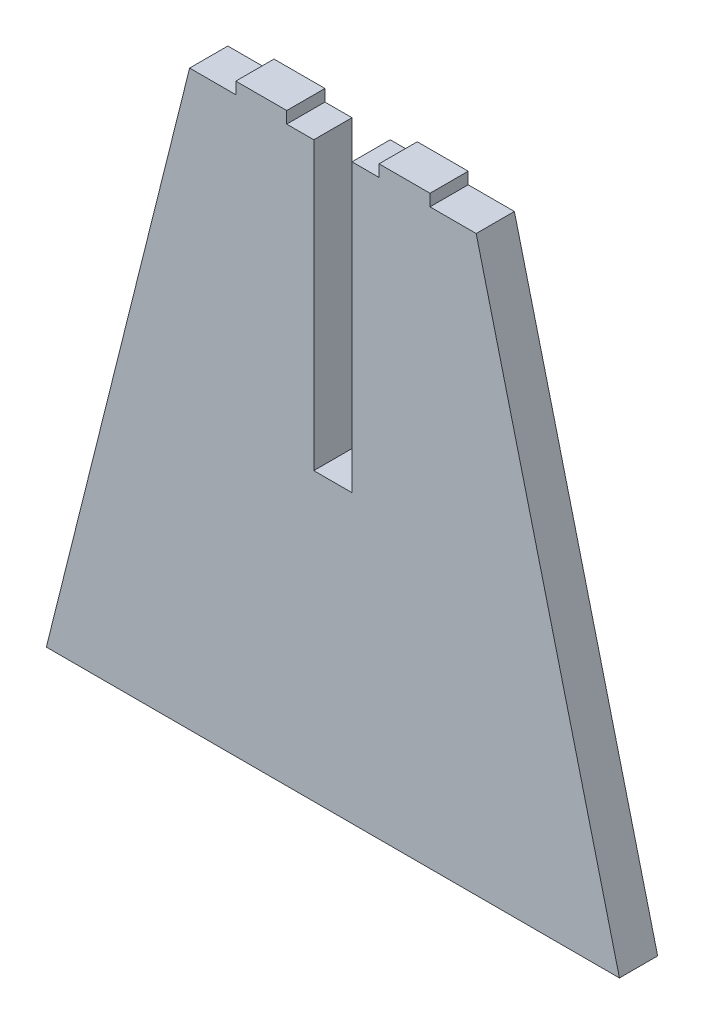
from build123d import *

# Parameters (mm, degrees)
BOSS_EXTRUDE1_DEPTH = 6


with BuildPart() as part:
    # Sketch1 → Boss-Extrude1 (new body)
    with BuildSketch(Plane.XY):
        Polygon((45, 15.633986602), (-45, 15.633986602), (-22.5, 105.633986602), (-15.25, 105.633986602), (-15.25, 107.485617393), (-7.25, 107.485617393), (-7.25, 105.633986602), (-3, 105.633986602), (-3, 60.633986602), (3, 60.633986602), (3, 105.633986602), (7.25, 105.633986602), (7.25, 107.485617393), (15.25, 107.485617393), (15.25, 105.633986602), (22.5, 105.633986602), align=None)
    extrude(amount=BOSS_EXTRUDE1_DEPTH)


solid = part.part
